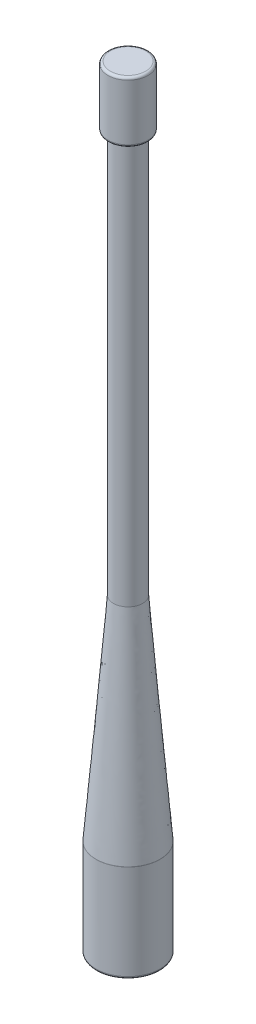
from build123d import *

# Parameters (mm, degrees)
SKETCH1_R           = 6.6675
BOSS_EXTRUDE1_DEPTH = 20.32
SKETCH4_R           = 3.048
BOSS_EXTRUDE2_DEPTH = 83.82
SKETCH5_R           = 4.191
BOSS_EXTRUDE3_DEPTH = 12.7
FILLET1_R           = 0.508


with BuildPart() as part:
    # Sketch1 → Boss-Extrude1 (new body)
    with BuildSketch(Plane(origin=(0, 0, 0), x_dir=(1, 0, 0), z_dir=(0, 1, 0))):
        with Locations(Location((0, 0, 0), (0, 0, 270))):
            Circle(SKETCH1_R)
    extrude(amount=BOSS_EXTRUDE1_DEPTH)

    # Loft1: read off the stored shape, not the designer's step
    # Loft1: loft between two sections, ruled curve by curve
    loft1_from = [
        Edge.make_bspline([(0.590355185, 64.77, -2.990281719), (6.570918622, 64.77, -1.809571349), (5.390208252, 64.77, 4.170992088), (-0.590355185, 64.77, 2.990281719), (-6.570918622, 64.77, 1.809571349), (-5.390208252, 64.77, -4.170992088), (0.590355185, 64.77, -2.990281719)], [0, 0, 0, 0, 0.5, 0.5, 0.5, 1, 1, 1, 1], 3, [1, 0.333333333, 0.333333333, 1, 0.333333333, 0.333333333, 1]),
    ]
    loft1_to = [
        Edge.make_bspline([(3.019513857, 20.32, -5.944585126), (14.908684109, 20.32, 0.094442589), (8.869656394, 20.32, 11.98361284), (-3.019513857, 20.32, 5.944585126), (-14.908684109, 20.32, -0.094442589), (-8.869656394, 20.32, -11.98361284), (3.019513857, 20.32, -5.944585126)], [0, 0, 0, 0, 0.5, 0.5, 0.5, 1, 1, 1, 1], 3, [1, 0.333333333, 0.333333333, 1, 0.333333333, 0.333333333, 1]),
    ]
    loft1 = Solid(Shell([*[Face.make_surface_from_curves(loft1_from[k], loft1_to[k]) for k in range(1)], Face(Wire(loft1_from)), Face(Wire(loft1_to))]))
    add(loft1)

    # Sketch4 → Boss-Extrude2 (add)
    with BuildSketch(Plane(origin=(0, 64.77, 0), x_dir=(1, 0, 0), z_dir=(0, 1, 0))):
        with Locations(Location((0, 0, 0), (0, 0, 78.832021496))):
            Circle(SKETCH4_R)
    extrude(amount=BOSS_EXTRUDE2_DEPTH)

    # Sketch5 → Boss-Extrude3 (add)
    with BuildSketch(Plane(origin=(0, 148.59, 0), x_dir=(1, 0, 0), z_dir=(0, 1, 0))):
        with Locations(Location((0, 0, 0), (0, 0, 270))):
            Circle(SKETCH5_R)
    extrude(amount=BOSS_EXTRUDE3_DEPTH)

    # Fillet1
    fillet1_edges = [part.edges().sort_by_distance(p)[0] for p in [
        (0, 148.59, -4.191),
        (0, 161.29, -4.191),
        (0, 0, -6.6675),
        (6.48425314, 20.32, 1.552423094),
    ]]
    fillet(fillet1_edges, radius=FILLET1_R)


solid = part.part
